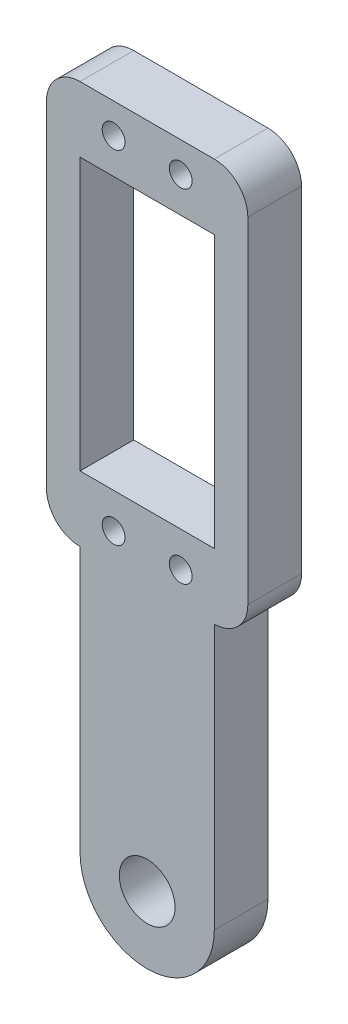
from build123d import *

# Parameters (mm, degrees)
SKETCH_1_W      = 30
SKETCH_1_H      = 60
SKETCH_1_R      = 1.7
SKETCH_1_W_2    = 20
SKETCH_1_H_2    = 40.5
SKETCH_1_R_2    = 10
SKETCH_1_R_3    = 4.15
EXTRUDE_1_DEPTH = 8
FILLET_1_R      = 5


with BuildPart() as part:
    # Эскиз1 → Бобышка-Вытянуть1 (new body)
    # profile 1 of 3: a face of its own
    with BuildSketch(Plane.XY):
        with Locations((0, 69.5)):
            Rectangle(SKETCH_1_W, SKETCH_1_H)
        with Locations((-5, 44)):
            Circle(SKETCH_1_R, mode=Mode.SUBTRACT)
        with Locations((5, 95)):
            Circle(SKETCH_1_R, mode=Mode.SUBTRACT)
        with Locations((-5, 95)):
            Circle(SKETCH_1_R, mode=Mode.SUBTRACT)
        with Locations((5, 44)):
            Circle(SKETCH_1_R, mode=Mode.SUBTRACT)
        with Locations((0, 69.5)):
            Rectangle(SKETCH_1_W_2, SKETCH_1_H_2, mode=Mode.SUBTRACT)
    # profile 2 of 3: a face of its own
    with BuildSketch(Plane.XY):
        Circle(SKETCH_1_R_2)
        Circle(SKETCH_1_R_3, mode=Mode.SUBTRACT)
    # profile 3 of 3: a face of its own
    with BuildSketch(Plane.XY):
        with BuildLine():
            Line((-10, 39.5), (-10, 0))
            ThreePointArc((-10, 0), (0, 10), (10, 0))
            Line((10, 0), (10, 39.5))
            Line((10, 39.5), (-10, 39.5))
        make_face()
    extrude(amount=EXTRUDE_1_DEPTH)

    # Скругление1
    fillet_1_edges = [part.edges().sort_by_distance(p)[0] for p in [
        (15, 39.5, 4),
        (-15, 39.5, 4),
        (-15, 99.5, 4),
        (15, 99.5, 4),
    ]]
    fillet(fillet_1_edges, radius=FILLET_1_R - 0.0001)  # a hair under: the kernel refuses the full size


solid = part.part
